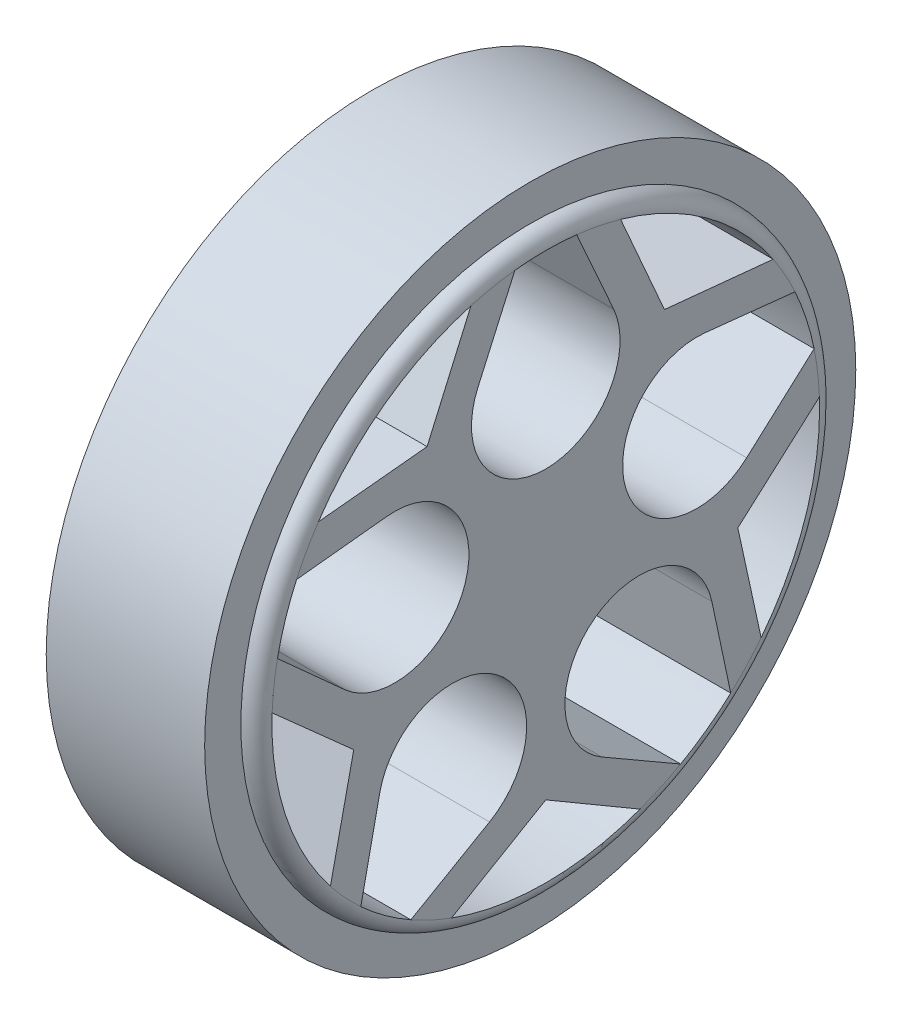
from build123d import *

# Parameters (mm, degrees)
SKETCH1_R           = 90
BOSS_EXTRUDE1_DEPTH = 43.8
SKETCH3_R           = 13
BOSS_EXTRUDE2_DEPTH = 22.5
SKETCH4_R           = 4
CUT_EXTRUDE1_DEPTH  = 20
SKETCH9_R           = 80
BOSS_EXTRUDE3_DEPTH = 4.3
FILLET1_R           = 4.3
CUT_EXTRUDE4_DEPTH  = 50


with BuildPart() as part:
    # Sketch1 → Boss-Extrude1 (new body)
    with BuildSketch(Plane(origin=(0, 0, 0), x_dir=(0, 0, -1), z_dir=(1, 0, 0))):
        Circle(SKETCH1_R)
    extrude(amount=BOSS_EXTRUDE1_DEPTH)

    # Sketch3 → Boss-Extrude2 (add)
    with BuildSketch(Plane.ZY):
        with Locations(Location((0, 0, 0), (0, 0, 180))):
            Circle(SKETCH3_R)
    extrude(amount=BOSS_EXTRUDE2_DEPTH)

    # Sketch4 → Cut-Extrude1 (cut)
    with BuildSketch(Plane.ZY.offset(22.5)):
        Circle(SKETCH4_R)
    extrude(amount=-CUT_EXTRUDE1_DEPTH, mode=Mode.SUBTRACT)

    # Sketch9 → Boss-Extrude3 (add)
    with BuildSketch(Plane(origin=(43.8, 0, 0), x_dir=(0, 0, -1), z_dir=(1, 0, 0))):
        Circle(SKETCH9_R)
    extrude(amount=BOSS_EXTRUDE3_DEPTH)

    # Fillet1
    fillet1_edges = [part.edges().sort_by_distance(p)[0] for p in [
        (48.1, 0, 80),
    ]]
    fillet(fillet1_edges, radius=FILLET1_R - 0.0001)  # a hair under: the kernel refuses the full size

    # Sketch13 → Cut-Extrude4 (cut)
    with BuildSketch(Plane.ZY):
        with BuildLine():
            Line((-74.177423439, 15.106285183), (-55.525432971, -1.688042469))
            ThreePointArc((-55.525432971, -1.688042469), (-22.247671799, 7.228706763), (-43.928812425, 34.002685672))
            Line((-43.928812425, 34.002685672), (-68.890047808, 31.379154116))
            ThreePointArc((-68.890047808, 31.379154116), (-71.994978284, 23.392586474), (-74.177423439, 15.106285183))
        make_face()
        with BuildLine():
            Line((-32.811134979, 45.160652975), (-20.684178649, 72.819329533))
            ThreePointArc((-20.684178649, 72.819329533), (-44.495343599, 61.242586474), (-62.863535147, 42.174233233))
            Line((-62.863535147, 42.174233233), (-32.811134979, 45.160652975))
        make_face()
        with BuildLine():
            Line((-8.555153481, 75.215020767), (-18.763726198, 52.286191037))
            ThreePointArc((-18.763726198, 52.286191037), (0, 23.392586474), (18.763726198, 52.286191037))
            Line((18.763726198, 52.286191037), (8.555153481, 75.215020767))
            ThreePointArc((8.555153481, 75.215020767), (0, 75.7), (-8.555153481, 75.215020767))
        make_face()
        with BuildLine():
            Line((32.811134979, 45.160652975), (62.863535147, 42.174233233))
            ThreePointArc((62.863535147, 42.174233233), (44.495343599, 61.242586474), (20.684178649, 72.819329533))
            Line((20.684178649, 72.819329533), (32.811134979, 45.160652975))
        make_face()
        with BuildLine():
            Line((74.177423439, 15.106285183), (55.525432971, -1.688042469))
            ThreePointArc((55.525432971, -1.688042469), (22.247671799, 7.228706763), (43.928812425, 34.002685672))
            Line((43.928812425, 34.002685672), (68.890047808, 31.379154116))
            ThreePointArc((68.890047808, 31.379154116), (71.994978284, 23.392586474), (74.177423439, 15.106285183))
        make_face()
        with BuildLine():
            Line((53.089531605, -17.249834482), (59.535980023, -46.754219945))
            ThreePointArc((59.535980023, -46.754219945), (71.994978284, -23.392586474), (75.647060582, 2.830587456))
            Line((75.647060582, 2.830587456), (53.089531605, -17.249834482))
        make_face()
        with BuildLine():
            Line((51.131544513, -55.821636985), (45.913225362, -31.271375583))
            ThreePointArc((45.913225362, -31.271375583), (13.749817343, -18.925), (15.552878618, -53.329458657))
            Line((15.552878618, -53.329458657), (37.289015401, -65.87882308))
            ThreePointArc((37.289015401, -65.87882308), (44.495343599, -61.242586474), (51.131544513, -55.821636985))
        make_face()
        with BuildLine():
            Line((0, -55.821636985), (-26.068275939, -71.069930277))
            ThreePointArc((-26.068275939, -71.069930277), (0, -75.7), (26.068275939, -71.069930277))
            Line((26.068275939, -71.069930277), (0, -55.821636985))
        make_face()
        with BuildLine():
            Line((-37.289015401, -65.87882308), (-15.552878618, -53.329458657))
            ThreePointArc((-15.552878618, -53.329458657), (-13.749817343, -18.925), (-45.913225362, -31.271375583))
            Line((-45.913225362, -31.271375583), (-51.131544513, -55.821636985))
            ThreePointArc((-51.131544513, -55.821636985), (-44.495343599, -61.242586474), (-37.289015401, -65.87882308))
        make_face()
        with BuildLine():
            Line((-53.089531605, -17.249834482), (-75.647060582, 2.830587456))
            ThreePointArc((-75.647060582, 2.830587456), (-71.994978284, -23.392586474), (-59.535980023, -46.754219945))
            Line((-59.535980023, -46.754219945), (-53.089531605, -17.249834482))
        make_face()
    extrude(amount=-CUT_EXTRUDE4_DEPTH, mode=Mode.SUBTRACT)


solid = part.part
